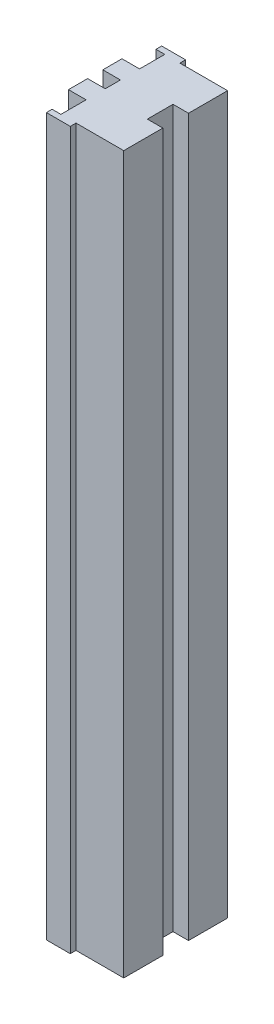
from build123d import *

# Parameters (mm, degrees)
EXTRUDE_1_DEPTH = 205.74


with BuildPart() as part:
    # Эскиз1 → Бобышка-Вытянуть1 (new body)
    with BuildSketch(Plane(origin=(0, 0, 0), x_dir=(1, 0, 0), z_dir=(0, 1, 0))):
        Polygon((-13.590964358, -14.912401284), (-13.590964358, -7.678772943), (-18.647761608, -7.678772943), (-18.647761608, -2.184214078), (-13.590964358, -2.184214078), (-13.590964358, 2.184214078), (-18.647761608, 2.184214078), (-18.647761608, 7.678772943), (-13.590964358, 7.678772943), (-13.590964358, 14.912401284), (-16.119362983, 14.912401284), (-16.119362983, 16.549688043), (-9.257867683, 16.549688043), (-9.257867683, 14.912401284), (4.451377447, 14.912401284), (4.451377447, 3.685533366), (0, 3.685533366), (0, -3.685533366), (4.451377447, -3.685533366), (4.451377447, -14.912401284), (-9.257867683, -14.912401284), (-9.257867683, -16.549688043), (-16.119362983, -16.549688043), (-16.119362983, -14.912401284), align=None)
    extrude(amount=EXTRUDE_1_DEPTH)


solid = part.part
